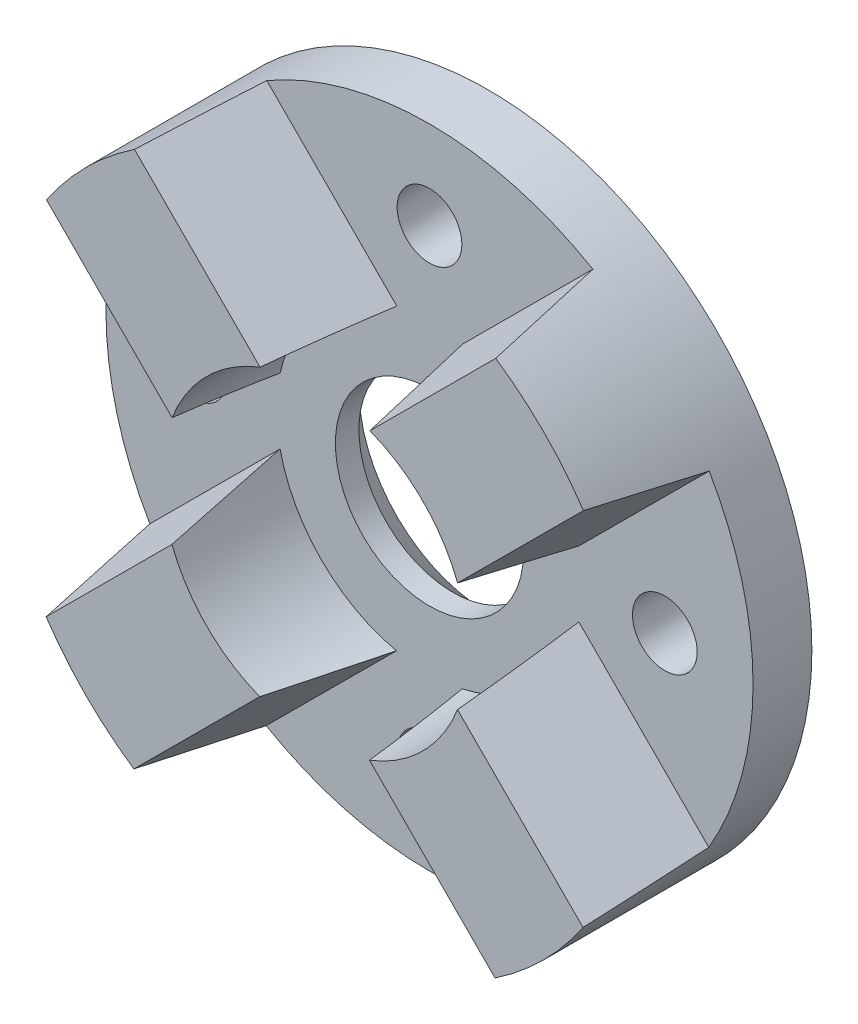
from build123d import *
from build123d.topology import SkipClean

# Parameters (mm, degrees)
SZKIC1_R                    = 11
SZKIC1_R_2                  = 1.1
SZKIC1_R_3                  = 3.2
DODANIE_WYCI_GNI_CIE1_DEPTH = 2
SFAZOWANIE1_SIZE            = 1.2
DODANIE_WYCI_GNI_CIE2_DEPTH = 3.9
SZYK_KO_OWY1_COUNT          = 4


with BuildPart() as part:
    # Szkic1 → Dodanie-wyciągnięcie1 (new body)
    with BuildSketch(Plane.XY):
        Circle(SZKIC1_R)
        with Locations((0, 8)):
            Circle(SZKIC1_R_2, mode=Mode.SUBTRACT)
        with Locations((8, 0)):
            Circle(SZKIC1_R_2, mode=Mode.SUBTRACT)
        with Locations((0, -8)):
            Circle(SZKIC1_R_2, mode=Mode.SUBTRACT)
        with Locations((-8, 0)):
            Circle(SZKIC1_R_2, mode=Mode.SUBTRACT)
        Circle(SZKIC1_R_3, mode=Mode.SUBTRACT)
    extrude(amount=DODANIE_WYCI_GNI_CIE1_DEPTH)

    # Sfazowanie1
    sfazowanie1_edges = [part.edges().sort_by_distance(p)[0] for p in [
        (-3.2, 0, 0),
    ]]
    chamfer(sfazowanie1_edges, length=SFAZOWANIE1_SIZE)

    # Szkic2 → Dodanie-wyciągnięcie2 (add)
    with BuildSketch(Plane.XY.offset(2)):
        with BuildLine():
            ThreePointArc((-1.985434, -4.806043), (-3.681187, -3.672719), (-4.810603, -1.974361))
            Line((-4.810603, -1.974361), (-9.069916, -6.223876))
            ThreePointArc((-9.069916, -6.223876), (-7.787126, -7.769213), (-6.244747, -9.055558))
            Line((-6.244747, -9.055558), (-1.985434, -4.806043))
        make_face()
    dodanie_wyci_gni_cie2 = extrude(amount=DODANIE_WYCI_GNI_CIE2_DEPTH)

    # Sfazowanie2
    # the kernel refuses this chamfer: 4.537025, 0.8 mm, written as the material it adds along each edge
    with BuildSketch(Plane(origin=(-9.583198, -12.386329, 2), x_dir=(0.6905216935845088, -0.6921137853794768, -0.21013876076743532), z_dir=(0.7079205386909484, 0.7062920861085148, 0))) as sfazowanie2_piece_1_section:
        with BuildLine():
            Line((0.850504, 0), (-1.021772, -4.603832))
            Line((-1.021772, -4.603832), (-1.110486, -4.584764))
            ThreePointArc((-1.110486, -4.584764), (-0.584195, -2.286159), (-0.088714, 0.019068))
            Line((-0.088714, 0.019068), (0.019068, 0.088714))
            ThreePointArc((0.019068, 0.088714), (0.425542, 0.001348), (0.869572, 0.088714))
            Line((0.869572, 0.088714), (0.850504, 0))
        make_face()
    sfazowanie2_piece_1 = extrude(amount=15.448363, mode=Mode.PRIVATE)
    sfazowanie2_piece_1 = sfazowanie2_piece_1 & Plane(origin=(0, 0, 3.473848), x_dir=(1, 0, 0), z_dir=(0, 0, -1)) * Cylinder(11, 50, mode=Mode.PRIVATE)
    sfazowanie2_piece_1 = sfazowanie2_piece_1 - Plane(origin=(0, 0, 3.473848), x_dir=(-0.38181431028836865, -0.9242390559043788, 0), z_dir=(0, 0, -1)) * Cylinder(5.2, 50, mode=Mode.PRIVATE)
    sfazowanie2_piece_1 = split(sfazowanie2_piece_1, bisect_by=Plane(origin=(-3.895318, -7.039482, 5.9), z_dir=(0, 0, -1)), keep=Keep.TOP, mode=Mode.PRIVATE)
    add(sfazowanie2_piece_1)
    with BuildSketch(Plane(origin=(-1.472152, 1.35641, 2), x_dir=(-0.690521693584509, 0.6921137853794764, -0.21013876076743535), z_dir=(-0.7079205386909481, -0.706292086108515, 0))) as sfazowanie2_piece_2_section:
        with BuildLine():
            Line((0.850504, 0), (-1.021772, -4.603832))
            Line((-1.021772, -4.603832), (-1.110486, -4.584764))
            ThreePointArc((-1.110486, -4.584764), (-0.584195, -2.286159), (-0.088714, 0.019068))
            Line((-0.088714, 0.019068), (0.019068, 0.088714))
            ThreePointArc((0.019068, 0.088714), (0.425542, 0.001348), (0.869572, 0.088714))
            Line((0.869572, 0.088714), (0.850504, 0))
        make_face()
    sfazowanie2_piece_2 = extrude(amount=15.448363, mode=Mode.PRIVATE)
    sfazowanie2_piece_2 = sfazowanie2_piece_2 - Plane(origin=(0, 0, 3.473848), x_dir=(-0.38181431028836865, -0.9242390559043788, 0), z_dir=(0, 0, -1)) * Cylinder(5.2, 50, mode=Mode.PRIVATE)
    sfazowanie2_piece_2 = sfazowanie2_piece_2 & Plane(origin=(0, 0, 3.473848), x_dir=(1, 0, 0), z_dir=(0, 0, -1)) * Cylinder(11, 50, mode=Mode.PRIVATE)
    sfazowanie2_piece_2 = split(sfazowanie2_piece_2, bisect_by=Plane(origin=(-7.048434, -3.879096, 5.9), z_dir=(0, 0, -1)), keep=Keep.TOP, mode=Mode.PRIVATE)
    add(sfazowanie2_piece_2)

    # Szyk kołowy1: Dodanie-wyciągnięcie2 ×4 about axis
    with SkipClean():  # the faces are left unmerged after this step: merging them gives an invalid solid
        szyk_ko_owy1_axis = Axis((0, 0, 0), (0, 0, 1))
        for i in range(1, SZYK_KO_OWY1_COUNT):
            add(dodanie_wyci_gni_cie2.rotate(szyk_ko_owy1_axis, i * 360 / SZYK_KO_OWY1_COUNT))

    # Sfazowanie2 of Szyk kołowy1
    # the kernel refuses this chamfer: 4.537025, 0.8 mm, written as the material it adds along each edge
    with BuildSketch(Plane(origin=(12.386329, -9.583198, 2), x_dir=(0.6921137853794768, 0.6905216935845088, -0.21013876076743532), z_dir=(-0.7062920861085147, 0.7079205386909485, 0))) as sfazowanie2_of_szyk_ko_owy1_piece_1_section:
        with BuildLine():
            Line((0.850504, 0), (-1.021772, -4.603832))
            Line((-1.021772, -4.603832), (-1.110486, -4.584764))
            ThreePointArc((-1.110486, -4.584764), (-0.584195, -2.286159), (-0.088714, 0.019068))
            Line((-0.088714, 0.019068), (0.019068, 0.088714))
            ThreePointArc((0.019068, 0.088714), (0.425542, 0.001348), (0.869572, 0.088714))
            Line((0.869572, 0.088714), (0.850504, 0))
        make_face()
    sfazowanie2_of_szyk_ko_owy1_piece_1 = extrude(amount=15.448363, mode=Mode.PRIVATE)
    sfazowanie2_of_szyk_ko_owy1_piece_1 = sfazowanie2_of_szyk_ko_owy1_piece_1 & Plane(origin=(0, 0, 3.473848), x_dir=(1, 0, 0), z_dir=(0, 0, -1)) * Cylinder(11, 50, mode=Mode.PRIVATE)
    sfazowanie2_of_szyk_ko_owy1_piece_1 = sfazowanie2_of_szyk_ko_owy1_piece_1 - Plane(origin=(0, 0, 3.473848), x_dir=(0.9242390559043788, -0.38181431028836876, 0), z_dir=(0, 0, -1)) * Cylinder(5.2, 50, mode=Mode.PRIVATE)
    sfazowanie2_of_szyk_ko_owy1_piece_1 = split(sfazowanie2_of_szyk_ko_owy1_piece_1, bisect_by=Plane(origin=(7.039482, -3.895318, 5.9), z_dir=(0, 0, -1)), keep=Keep.TOP, mode=Mode.PRIVATE)
    add(sfazowanie2_of_szyk_ko_owy1_piece_1)
    with BuildSketch(Plane(origin=(-1.35641, -1.472152, 2), x_dir=(-0.6921137853794764, -0.690521693584509, -0.21013876076743537), z_dir=(0.7062920861085149, -0.7079205386909482, 0))) as sfazowanie2_of_szyk_ko_owy1_piece_2_section:
        with BuildLine():
            Line((0.850504, 0), (-1.021772, -4.603832))
            Line((-1.021772, -4.603832), (-1.110486, -4.584764))
            ThreePointArc((-1.110486, -4.584764), (-0.584195, -2.286159), (-0.088714, 0.019068))
            Line((-0.088714, 0.019068), (0.019068, 0.088714))
            ThreePointArc((0.019068, 0.088714), (0.425542, 0.001348), (0.869572, 0.088714))
            Line((0.869572, 0.088714), (0.850504, 0))
        make_face()
    sfazowanie2_of_szyk_ko_owy1_piece_2 = extrude(amount=15.448363, mode=Mode.PRIVATE)
    sfazowanie2_of_szyk_ko_owy1_piece_2 = sfazowanie2_of_szyk_ko_owy1_piece_2 - Plane(origin=(0, 0, 3.473848), x_dir=(0.9242390559043788, -0.38181431028836876, 0), z_dir=(0, 0, -1)) * Cylinder(5.2, 50, mode=Mode.PRIVATE)
    sfazowanie2_of_szyk_ko_owy1_piece_2 = sfazowanie2_of_szyk_ko_owy1_piece_2 & Plane(origin=(0, 0, 3.473848), x_dir=(1, 0, 0), z_dir=(0, 0, -1)) * Cylinder(11, 50, mode=Mode.PRIVATE)
    sfazowanie2_of_szyk_ko_owy1_piece_2 = split(sfazowanie2_of_szyk_ko_owy1_piece_2, bisect_by=Plane(origin=(3.879096, -7.048434, 5.9), z_dir=(0, 0, -1)), keep=Keep.TOP, mode=Mode.PRIVATE)
    add(sfazowanie2_of_szyk_ko_owy1_piece_2)
    with BuildSketch(Plane(origin=(9.583198, 12.386329, 2), x_dir=(-0.6905216935845088, 0.6921137853794768, -0.21013876076743532), z_dir=(-0.7079205386909485, -0.7062920861085147, 0))) as sfazowanie2_of_szyk_ko_owy1_piece_3_section:
        with BuildLine():
            Line((0.850504, 0), (-1.021772, -4.603832))
            Line((-1.021772, -4.603832), (-1.110486, -4.584764))
            ThreePointArc((-1.110486, -4.584764), (-0.584195, -2.286159), (-0.088714, 0.019068))
            Line((-0.088714, 0.019068), (0.019068, 0.088714))
            ThreePointArc((0.019068, 0.088714), (0.425542, 0.001348), (0.869572, 0.088714))
            Line((0.869572, 0.088714), (0.850504, 0))
        make_face()
    sfazowanie2_of_szyk_ko_owy1_piece_3 = extrude(amount=15.448363, mode=Mode.PRIVATE)
    sfazowanie2_of_szyk_ko_owy1_piece_3 = sfazowanie2_of_szyk_ko_owy1_piece_3 & Plane(origin=(0, 0, 3.473848), x_dir=(1, 0, 0), z_dir=(0, 0, -1)) * Cylinder(11, 50, mode=Mode.PRIVATE)
    sfazowanie2_of_szyk_ko_owy1_piece_3 = sfazowanie2_of_szyk_ko_owy1_piece_3 - Plane(origin=(0, 0, 3.473848), x_dir=(0.38181431028836876, 0.9242390559043788, 0), z_dir=(0, 0, -1)) * Cylinder(5.2, 50, mode=Mode.PRIVATE)
    sfazowanie2_of_szyk_ko_owy1_piece_3 = split(sfazowanie2_of_szyk_ko_owy1_piece_3, bisect_by=Plane(origin=(3.895318, 7.039482, 5.9), z_dir=(0, 0, -1)), keep=Keep.TOP, mode=Mode.PRIVATE)
    add(sfazowanie2_of_szyk_ko_owy1_piece_3)
    with BuildSketch(Plane(origin=(1.472152, -1.35641, 2), x_dir=(0.6905216935845091, -0.6921137853794765, -0.21013876076743537), z_dir=(0.7079205386909482, 0.7062920861085149, 0))) as sfazowanie2_of_szyk_ko_owy1_piece_4_section:
        with BuildLine():
            Line((0.850504, 0), (-1.021772, -4.603832))
            Line((-1.021772, -4.603832), (-1.110486, -4.584764))
            ThreePointArc((-1.110486, -4.584764), (-0.584195, -2.286159), (-0.088714, 0.019068))
            Line((-0.088714, 0.019068), (0.019068, 0.088714))
            ThreePointArc((0.019068, 0.088714), (0.425542, 0.001348), (0.869572, 0.088714))
            Line((0.869572, 0.088714), (0.850504, 0))
        make_face()
    sfazowanie2_of_szyk_ko_owy1_piece_4 = extrude(amount=15.448363, mode=Mode.PRIVATE)
    sfazowanie2_of_szyk_ko_owy1_piece_4 = sfazowanie2_of_szyk_ko_owy1_piece_4 - Plane(origin=(0, 0, 3.473848), x_dir=(0.38181431028836876, 0.9242390559043788, 0), z_dir=(0, 0, -1)) * Cylinder(5.2, 50, mode=Mode.PRIVATE)
    sfazowanie2_of_szyk_ko_owy1_piece_4 = sfazowanie2_of_szyk_ko_owy1_piece_4 & Plane(origin=(0, 0, 3.473848), x_dir=(1, 0, 0), z_dir=(0, 0, -1)) * Cylinder(11, 50, mode=Mode.PRIVATE)
    sfazowanie2_of_szyk_ko_owy1_piece_4 = split(sfazowanie2_of_szyk_ko_owy1_piece_4, bisect_by=Plane(origin=(7.048434, 3.879096, 5.9), z_dir=(0, 0, -1)), keep=Keep.TOP, mode=Mode.PRIVATE)
    add(sfazowanie2_of_szyk_ko_owy1_piece_4)
    with BuildSketch(Plane(origin=(-12.386329, 9.583198, 2), x_dir=(-0.6921137853794768, -0.6905216935845088, -0.21013876076743532), z_dir=(0.7062920861085147, -0.7079205386909485, 0))) as sfazowanie2_of_szyk_ko_owy1_piece_5_section:
        with BuildLine():
            Line((0.850504, 0), (-1.021772, -4.603832))
            Line((-1.021772, -4.603832), (-1.110486, -4.584764))
            ThreePointArc((-1.110486, -4.584764), (-0.584195, -2.286159), (-0.088714, 0.019068))
            Line((-0.088714, 0.019068), (0.019068, 0.088714))
            ThreePointArc((0.019068, 0.088714), (0.425542, 0.001348), (0.869572, 0.088714))
            Line((0.869572, 0.088714), (0.850504, 0))
        make_face()
    sfazowanie2_of_szyk_ko_owy1_piece_5 = extrude(amount=15.448363, mode=Mode.PRIVATE)
    sfazowanie2_of_szyk_ko_owy1_piece_5 = sfazowanie2_of_szyk_ko_owy1_piece_5 & Plane(origin=(0, 0, 3.473848), x_dir=(1, 0, 0), z_dir=(0, 0, -1)) * Cylinder(11, 50, mode=Mode.PRIVATE)
    sfazowanie2_of_szyk_ko_owy1_piece_5 = sfazowanie2_of_szyk_ko_owy1_piece_5 - Plane(origin=(0, 0, 3.473848), x_dir=(-0.9242390559043787, 0.3818143102883689, 0), z_dir=(0, 0, -1)) * Cylinder(5.2, 50, mode=Mode.PRIVATE)
    sfazowanie2_of_szyk_ko_owy1_piece_5 = split(sfazowanie2_of_szyk_ko_owy1_piece_5, bisect_by=Plane(origin=(-7.039482, 3.895318, 5.9), z_dir=(0, 0, -1)), keep=Keep.TOP, mode=Mode.PRIVATE)
    add(sfazowanie2_of_szyk_ko_owy1_piece_5)
    with BuildSketch(Plane(origin=(1.35641, 1.472152, 2), x_dir=(0.6921137853794764, 0.690521693584509, -0.21013876076743535), z_dir=(-0.7062920861085149, 0.7079205386909482, 0))) as sfazowanie2_of_szyk_ko_owy1_piece_6_section:
        with BuildLine():
            Line((0.850504, 0), (-1.021772, -4.603832))
            Line((-1.021772, -4.603832), (-1.110486, -4.584764))
            ThreePointArc((-1.110486, -4.584764), (-0.584195, -2.286159), (-0.088714, 0.019068))
            Line((-0.088714, 0.019068), (0.019068, 0.088714))
            ThreePointArc((0.019068, 0.088714), (0.425542, 0.001348), (0.869572, 0.088714))
            Line((0.869572, 0.088714), (0.850504, 0))
        make_face()
    sfazowanie2_of_szyk_ko_owy1_piece_6 = extrude(amount=15.448363, mode=Mode.PRIVATE)
    sfazowanie2_of_szyk_ko_owy1_piece_6 = sfazowanie2_of_szyk_ko_owy1_piece_6 - Plane(origin=(0, 0, 3.473848), x_dir=(-0.9242390559043787, 0.3818143102883689, 0), z_dir=(0, 0, -1)) * Cylinder(5.2, 50, mode=Mode.PRIVATE)
    sfazowanie2_of_szyk_ko_owy1_piece_6 = sfazowanie2_of_szyk_ko_owy1_piece_6 & Plane(origin=(0, 0, 3.473848), x_dir=(1, 0, 0), z_dir=(0, 0, -1)) * Cylinder(11, 50, mode=Mode.PRIVATE)
    sfazowanie2_of_szyk_ko_owy1_piece_6 = split(sfazowanie2_of_szyk_ko_owy1_piece_6, bisect_by=Plane(origin=(-3.879096, 7.048434, 5.9), z_dir=(0, 0, -1)), keep=Keep.TOP, mode=Mode.PRIVATE)
    add(sfazowanie2_of_szyk_ko_owy1_piece_6)


solid = part.part
